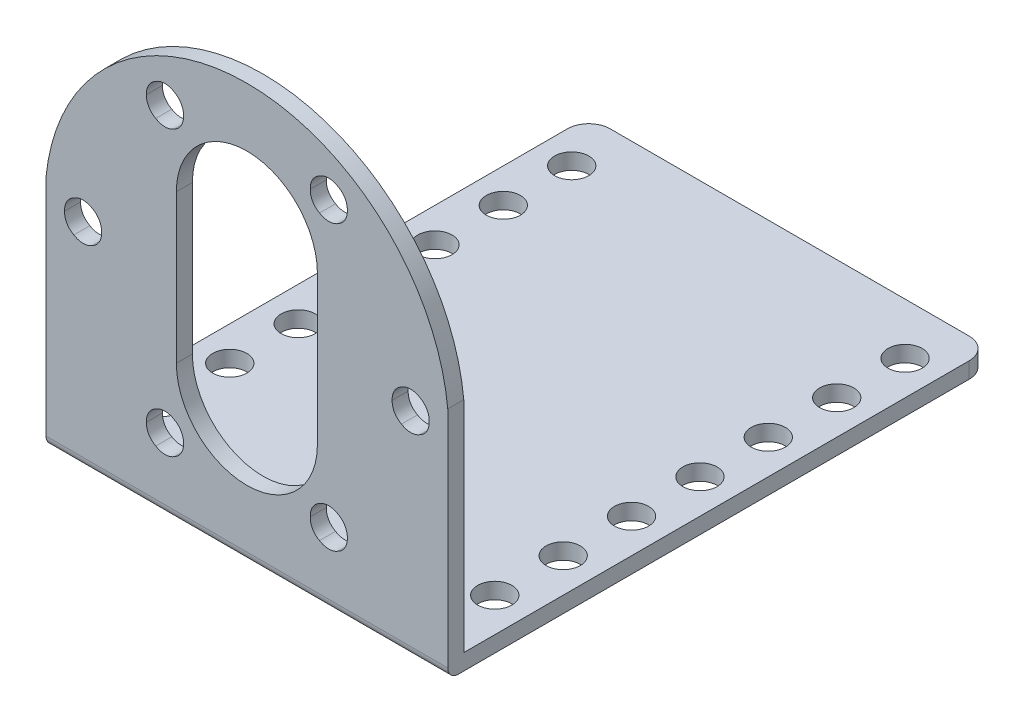
from build123d import *

# Parameters (mm, degrees)
BOSS_EXTRUDE1_DEPTH     = 1.5
SKETCH2_W               = 37.6
SKETCH2_H               = 50.8
BOSS_EXTRUDE2_DEPTH     = 1.5
FILLET1_R               = 1
FILLET2_R               = 2
CUT_EXTRUDE1_REACH      = 67.612
SKETCH3_R               = 1.6
LPATTERN1_COUNT         = 7
LPATTERN1_PITCH         = 6.4
MIRROR1_COPY_1_REACH    = 67.612
MIRROR1_COPY_1_SKETCH_R = 1.6
MIRROR1_COPY_2_REACH    = 67.612
MIRROR1_COPY_2_SKETCH_R = 1.6
MIRROR1_COPY_3_REACH    = 67.612
MIRROR1_COPY_3_SKETCH_R = 1.6
MIRROR1_COPY_4_REACH    = 67.612
MIRROR1_COPY_4_SKETCH_R = 1.6
MIRROR1_COPY_5_REACH    = 67.612
MIRROR1_COPY_5_SKETCH_R = 1.6
MIRROR1_COPY_6_REACH    = 67.612
MIRROR1_COPY_6_SKETCH_R = 1.6
CUT_EXTRUDE2_REACH      = 68.746
SKETCH4_R               = 1.6
CIRPATTERN1_COUNT       = 6


with BuildPart() as part:
    # Sketch1 → Boss-Extrude1 (new body)
    with BuildSketch(Plane.XY):
        with BuildLine():
            Line((-18.8, 0), (18.8, 0))
            Line((18.8, 0), (18.8, 22))
            ThreePointArc((18.8, 22), (0, 39), (-18.8, 22))
            Line((-18.8, 22), (-18.8, 0))
        make_face()
        with BuildLine():
            Line((-6.6, 12.999434154), (-6.6, 26.899434154))
            ThreePointArc((-6.6, 26.899434154), (0, 33.5), (6.6, 26.899434154))
            Line((6.6, 26.899434154), (6.6, 12.999434154))
            ThreePointArc((6.6, 12.999434154), (0, 6.399999946), (-6.6, 12.999434154))
        make_face(mode=Mode.SUBTRACT)
    extrude(amount=BOSS_EXTRUDE1_DEPTH)

    # Sketch2 → Boss-Extrude2 (add)
    with BuildSketch(Plane.XZ):
        with Locations((0, -23.9)):
            Rectangle(SKETCH2_W, SKETCH2_H)
    extrude(amount=-BOSS_EXTRUDE2_DEPTH)

    # Fillet1
    fillet1_edges = [part.edges().sort_by_distance(p)[0] for p in [
        (0, 0, 1.5),
    ]]
    fillet(fillet1_edges, radius=FILLET1_R)

    # Fillet2
    fillet2_edges = [part.edges().sort_by_distance(p)[0] for p in [
        (-18.8, 0.75, -49.3),
        (18.8, 0.75, -49.3),
    ]]
    fillet(fillet2_edges, radius=FILLET2_R)

    # Sketch3 → Cut-Extrude1 (cut, up to next)
    with BuildSketch(Plane.XZ, mode=Mode.PRIVATE) as cut_extrude1_sk1:
        with Locations((-15.6, -44.5)):
            Circle(SKETCH3_R)
    cut_extrude1_tool1 = extrude(cut_extrude1_sk1.sketch, amount=-CUT_EXTRUDE1_REACH, mode=Mode.PRIVATE) & part.part
    cut_extrude1 = cut_extrude1_tool1.solids().sort_by_distance((-15.6, 0, -44.5))[0]
    add(cut_extrude1, mode=Mode.SUBTRACT)

    # LPattern1: Cut-Extrude1 ×7
    with Locations(*[(0, 0, i * LPATTERN1_PITCH) for i in range(1, LPATTERN1_COUNT)]):
        add(cut_extrude1, mode=Mode.SUBTRACT)

    # Mirror1: Cut-Extrude1 across plane
    add(cut_extrude1.mirror(Plane(origin=(0, 0, 0), x_dir=(0, 0, 1), z_dir=(1, 0, 0))), mode=Mode.SUBTRACT)

    # Mirror1 copy 1 sketch → Mirror1 copy 1 (cut, up to next)
    with BuildSketch(Plane(origin=(0, 0, 6.4), x_dir=(-1, 0, 0), z_dir=(0, -1, 0)), mode=Mode.PRIVATE) as mirror1_copy_1_sk1:
        with Locations((-15.6, 44.5)):
            Circle(MIRROR1_COPY_1_SKETCH_R)
    mirror1_copy_1_tool1 = extrude(mirror1_copy_1_sk1.sketch, amount=-MIRROR1_COPY_1_REACH, mode=Mode.PRIVATE) & part.part
    add(mirror1_copy_1_tool1.solids().sort_by_distance((15.6, 0, -38.1))[0], mode=Mode.SUBTRACT)

    # Mirror1 copy 2 sketch → Mirror1 copy 2 (cut, up to next)
    with BuildSketch(Plane(origin=(0, 0, 12.8), x_dir=(-1, 0, 0), z_dir=(0, -1, 0)), mode=Mode.PRIVATE) as mirror1_copy_2_sk1:
        with Locations((-15.6, 44.5)):
            Circle(MIRROR1_COPY_2_SKETCH_R)
    mirror1_copy_2_tool1 = extrude(mirror1_copy_2_sk1.sketch, amount=-MIRROR1_COPY_2_REACH, mode=Mode.PRIVATE) & part.part
    add(mirror1_copy_2_tool1.solids().sort_by_distance((15.6, 0, -31.7))[0], mode=Mode.SUBTRACT)

    # Mirror1 copy 3 sketch → Mirror1 copy 3 (cut, up to next)
    with BuildSketch(Plane(origin=(0, 0, 19.2), x_dir=(-1, 0, 0), z_dir=(0, -1, 0)), mode=Mode.PRIVATE) as mirror1_copy_3_sk1:
        with Locations((-15.6, 44.5)):
            Circle(MIRROR1_COPY_3_SKETCH_R)
    mirror1_copy_3_tool1 = extrude(mirror1_copy_3_sk1.sketch, amount=-MIRROR1_COPY_3_REACH, mode=Mode.PRIVATE) & part.part
    add(mirror1_copy_3_tool1.solids().sort_by_distance((15.6, 0, -25.3))[0], mode=Mode.SUBTRACT)

    # Mirror1 copy 4 sketch → Mirror1 copy 4 (cut, up to next)
    with BuildSketch(Plane(origin=(0, 0, 25.6), x_dir=(-1, 0, 0), z_dir=(0, -1, 0)), mode=Mode.PRIVATE) as mirror1_copy_4_sk1:
        with Locations((-15.6, 44.5)):
            Circle(MIRROR1_COPY_4_SKETCH_R)
    mirror1_copy_4_tool1 = extrude(mirror1_copy_4_sk1.sketch, amount=-MIRROR1_COPY_4_REACH, mode=Mode.PRIVATE) & part.part
    add(mirror1_copy_4_tool1.solids().sort_by_distance((15.6, 0, -18.9))[0], mode=Mode.SUBTRACT)

    # Mirror1 copy 5 sketch → Mirror1 copy 5 (cut, up to next)
    with BuildSketch(Plane(origin=(0, 0, 32), x_dir=(-1, 0, 0), z_dir=(0, -1, 0)), mode=Mode.PRIVATE) as mirror1_copy_5_sk1:
        with Locations((-15.6, 44.5)):
            Circle(MIRROR1_COPY_5_SKETCH_R)
    mirror1_copy_5_tool1 = extrude(mirror1_copy_5_sk1.sketch, amount=-MIRROR1_COPY_5_REACH, mode=Mode.PRIVATE) & part.part
    add(mirror1_copy_5_tool1.solids().sort_by_distance((15.6, 0, -12.5))[0], mode=Mode.SUBTRACT)

    # Mirror1 copy 6 sketch → Mirror1 copy 6 (cut, up to next)
    with BuildSketch(Plane(origin=(0, 0, 38.4), x_dir=(-1, 0, 0), z_dir=(0, -1, 0)), mode=Mode.PRIVATE) as mirror1_copy_6_sk1:
        with Locations((-15.6, 44.5)):
            Circle(MIRROR1_COPY_6_SKETCH_R)
    mirror1_copy_6_tool1 = extrude(mirror1_copy_6_sk1.sketch, amount=-MIRROR1_COPY_6_REACH, mode=Mode.PRIVATE) & part.part
    add(mirror1_copy_6_tool1.solids().sort_by_distance((15.6, 0, -6.1))[0], mode=Mode.SUBTRACT)

    # Sketch4 → Cut-Extrude2 (cut, up to next)
    with BuildSketch(Plane.XY.offset(1.5), mode=Mode.PRIVATE) as cut_extrude2_sk1:
        with Locations((7.664771385, 33.22577344)):
            Circle(SKETCH4_R)
    cut_extrude2_tool1 = extrude(cut_extrude2_sk1.sketch, amount=-CUT_EXTRUDE2_REACH, mode=Mode.PRIVATE) & part.part
    # Sketch4 → Cut-Extrude2 (cut, up to next)
    with BuildSketch(Plane.XY.offset(1.5), mode=Mode.PRIVATE) as cut_extrude2_sk2:
        with Locations((15.32954277, 19.949999973)):
            Circle(SKETCH4_R)
    cut_extrude2_tool2 = extrude(cut_extrude2_sk2.sketch, amount=-CUT_EXTRUDE2_REACH, mode=Mode.PRIVATE) & part.part
    # Sketch4 → Cut-Extrude2 (cut, up to next)
    with BuildSketch(Plane.XY.offset(1.5), mode=Mode.PRIVATE) as cut_extrude2_sk3:
        with Locations((7.664771385, 6.674226506)):
            Circle(SKETCH4_R)
    cut_extrude2_tool3 = extrude(cut_extrude2_sk3.sketch, amount=-CUT_EXTRUDE2_REACH, mode=Mode.PRIVATE) & part.part
    # Sketch4 → Cut-Extrude2 (cut, up to next)
    with BuildSketch(Plane.XY.offset(1.5), mode=Mode.PRIVATE) as cut_extrude2_sk4:
        with Locations((-7.664771385, 6.674226506)):
            Circle(SKETCH4_R)
    cut_extrude2_tool4 = extrude(cut_extrude2_sk4.sketch, amount=-CUT_EXTRUDE2_REACH, mode=Mode.PRIVATE) & part.part
    # Sketch4 → Cut-Extrude2 (cut, up to next)
    with BuildSketch(Plane.XY.offset(1.5), mode=Mode.PRIVATE) as cut_extrude2_sk5:
        with Locations((-15.32954277, 19.949999973)):
            Circle(SKETCH4_R)
    cut_extrude2_tool5 = extrude(cut_extrude2_sk5.sketch, amount=-CUT_EXTRUDE2_REACH, mode=Mode.PRIVATE) & part.part
    # Sketch4 → Cut-Extrude2 (cut, up to next)
    with BuildSketch(Plane.XY.offset(1.5), mode=Mode.PRIVATE) as cut_extrude2_sk6:
        with Locations((-7.664771385, 33.22577344)):
            Circle(SKETCH4_R)
    cut_extrude2_tool6 = extrude(cut_extrude2_sk6.sketch, amount=-CUT_EXTRUDE2_REACH, mode=Mode.PRIVATE) & part.part
    cut_extrude2_1 = cut_extrude2_tool1.solids().sort_by_distance((7.664771, 33.225773, 1.5))[0]
    add(cut_extrude2_1, mode=Mode.SUBTRACT)
    cut_extrude2_2 = cut_extrude2_tool2.solids().sort_by_distance((15.329543, 19.95, 1.5))[0]
    add(cut_extrude2_2, mode=Mode.SUBTRACT)
    cut_extrude2_3 = cut_extrude2_tool3.solids().sort_by_distance((7.664771, 6.674227, 1.5))[0]
    add(cut_extrude2_3, mode=Mode.SUBTRACT)
    cut_extrude2_4 = cut_extrude2_tool4.solids().sort_by_distance((-7.664771, 6.674227, 1.5))[0]
    add(cut_extrude2_4, mode=Mode.SUBTRACT)
    cut_extrude2_5 = cut_extrude2_tool5.solids().sort_by_distance((-15.329543, 19.95, 1.5))[0]
    add(cut_extrude2_5, mode=Mode.SUBTRACT)
    cut_extrude2_6 = cut_extrude2_tool6.solids().sort_by_distance((-7.664771, 33.225773, 1.5))[0]
    add(cut_extrude2_6, mode=Mode.SUBTRACT)
    cut_extrude2 = cut_extrude2_1 + cut_extrude2_2 + cut_extrude2_3 + cut_extrude2_4 + cut_extrude2_5 + cut_extrude2_6  # Cut-Extrude2 as one shape, for the pattern or mirror that repeats it

    # CirPattern1: Cut-Extrude2 ×6 about axis
    cirpattern1_axis = Axis((0, 20.104705882, 1.5), (0, 0, -1))
    for i in range(1, CIRPATTERN1_COUNT):
        add(cut_extrude2.rotate(cirpattern1_axis, i * 360 / CIRPATTERN1_COUNT), mode=Mode.SUBTRACT)


solid = part.part
